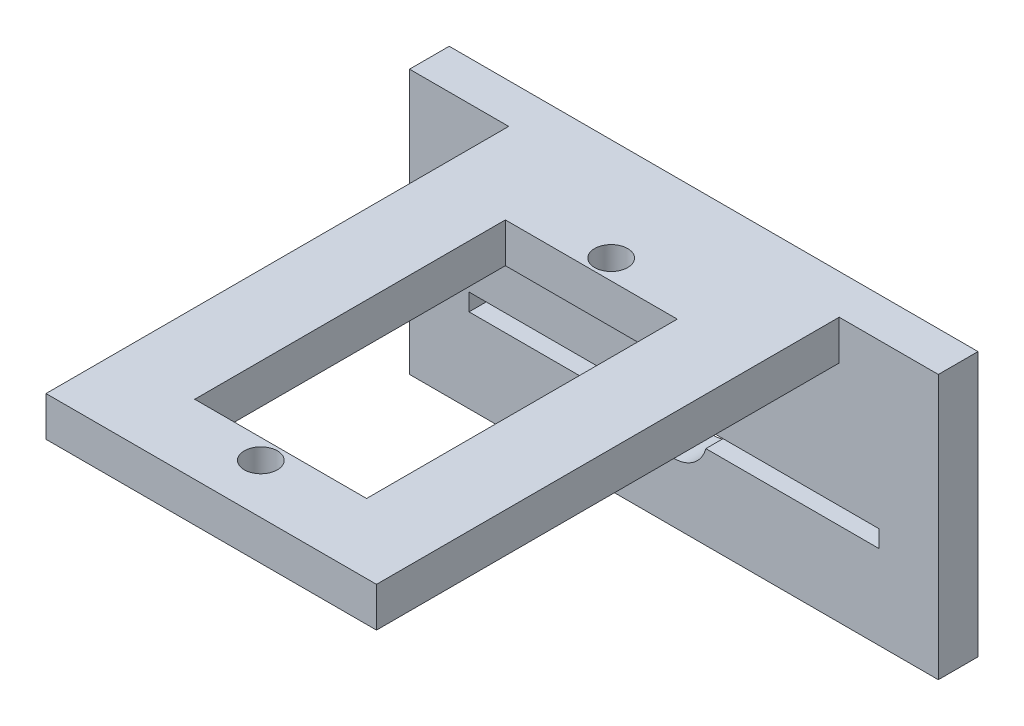
from build123d import *

# Parameters (mm, degrees)
ESBO_O1_W                         = 40
ESBO_O1_H                         = 20
RESSALTO_EXTRUS_O1_DEPTH          = 1
ESBO_O3_W                         = 40
ESBO_O3_H                         = 20
RESSALTO_EXTRUS_O2_DEPTH          = 2
CORTE_EXTRUS_O1_REACH             = 25.409
CORTE_EXTRUS_O1_DIRECTION_2_REACH = 25.409
ESBO_O4_W                         = 25
ESBO_O4_H                         = 38
ESBO_O4_R                         = 1.25
ESBO_O4_W_2                       = 13
ESBO_O4_H_2                       = 23.5
RESSALTO_EXTRUS_O3_DEPTH          = 3


with BuildPart() as part:
    # Esboço1 → Ressalto-extrusão1 (new body)
    with BuildSketch(Plane.XY):
        with Locations((0, -2)):
            Rectangle(ESBO_O1_W, ESBO_O1_H)
    extrude(amount=-RESSALTO_EXTRUS_O1_DEPTH)

    # Esboço3 → Ressalto-extrusão2 (add)
    with BuildSketch(Plane.XY):
        with Locations((0, -2)):
            Rectangle(ESBO_O3_W, ESBO_O3_H)
    extrude(amount=RESSALTO_EXTRUS_O2_DEPTH)

    # Corte-extrusão1: up to this face of the body (flat: up to its plane)
    corte_extrus_o1_end = Plane(part.part.faces().sort_by_distance((0, -2, 2))[0])
    # Esboço2 → Corte-extrusão1 (cut, up to the picked face)
    with BuildSketch(Plane.XY, mode=Mode.PRIVATE) as corte_extrus_o1_sk1:
        with BuildLine():
            Line((-2.414021541, -4.35), (-15.5, -4.35))
            Line((-15.5, -4.35), (-15.5, -5.65))
            Line((-15.5, -5.65), (-2.414021541, -5.65))
            ThreePointArc((-2.414021541, -5.65), (0, -7.5), (2.414021541, -5.65))
            Line((2.414021541, -5.65), (15.5, -5.65))
            Line((15.5, -5.65), (15.5, -4.35))
            Line((15.5, -4.35), (2.414021541, -4.35))
            ThreePointArc((2.414021541, -4.35), (0, -2.5), (-2.414021541, -4.35))
        make_face()
    corte_extrus_o1_tool1 = split(extrude(corte_extrus_o1_sk1.sketch, amount=CORTE_EXTRUS_O1_REACH, mode=Mode.PRIVATE), bisect_by=corte_extrus_o1_end, keep=Keep.BOTH, mode=Mode.PRIVATE)
    add(corte_extrus_o1_tool1.solids().sort_by(Axis((0, -5, 0), (0, 0, 1)))[0], mode=Mode.SUBTRACT)

    # Corte-extrusão1 direction 2: up to this face of the body (flat: up to its plane)
    corte_extrus_o1_direction_2_end = Plane(part.part.faces().sort_by_distance((0, -2, -1))[0])
    # Esboço2 → Corte-extrusão1 direction 2 (cut, up to the picked face)
    with BuildSketch(Plane.XY, mode=Mode.PRIVATE) as corte_extrus_o1_direction_2_sk1:
        with BuildLine():
            Line((-2.414021541, -4.35), (-15.5, -4.35))
            Line((-15.5, -4.35), (-15.5, -5.65))
            Line((-15.5, -5.65), (-2.414021541, -5.65))
            ThreePointArc((-2.414021541, -5.65), (0, -7.5), (2.414021541, -5.65))
            Line((2.414021541, -5.65), (15.5, -5.65))
            Line((15.5, -5.65), (15.5, -4.35))
            Line((15.5, -4.35), (2.414021541, -4.35))
            ThreePointArc((2.414021541, -4.35), (0, -2.5), (-2.414021541, -4.35))
        make_face()
    corte_extrus_o1_direction_2_tool1 = split(extrude(corte_extrus_o1_direction_2_sk1.sketch, amount=-CORTE_EXTRUS_O1_DIRECTION_2_REACH, mode=Mode.PRIVATE), bisect_by=corte_extrus_o1_direction_2_end, keep=Keep.BOTH, mode=Mode.PRIVATE)
    add(corte_extrus_o1_direction_2_tool1.solids().sort_by(Axis((0, -5, 0), (0, 0, -1)))[0], mode=Mode.SUBTRACT)

    # Esboço4 → Ressalto-extrusão3 (add)
    with BuildSketch(Plane(origin=(0, 8, 0), x_dir=(1, 0, 0), z_dir=(0, 1, 0))):
        with Locations((0, -18)):
            Rectangle(ESBO_O4_W, ESBO_O4_H)
        with Locations((0, -33.25)):
            Circle(ESBO_O4_R, mode=Mode.SUBTRACT)
        with Locations((0, -20)):
            Rectangle(ESBO_O4_W_2, ESBO_O4_H_2, mode=Mode.SUBTRACT)
        with Locations((0, -6.75)):
            Circle(ESBO_O4_R, mode=Mode.SUBTRACT)
    extrude(amount=-RESSALTO_EXTRUS_O3_DEPTH)


solid = part.part
